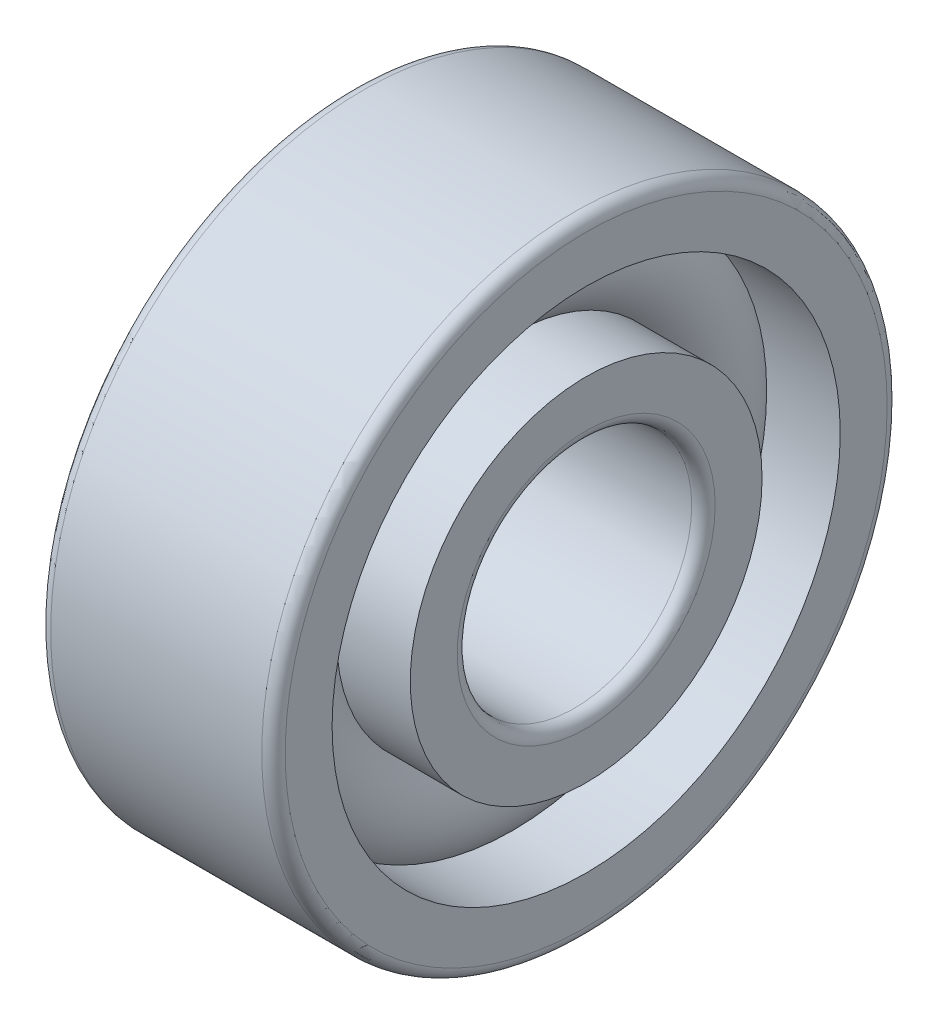
from build123d import *

# Parameters (mm, degrees)
CAGSPISKE_W     = 0.15
CAGSPISKE_H     = 0.25
CAGESPINE_ANGLE = 0.001
BALSIMSKE_R     = 0.75


with BuildPart() as part:
    # CagSpiSke → CageSpine (revolve)
    with BuildSketch(Plane.XY):
        with Locations((0, 2.75)):
            Rectangle(CAGSPISKE_W, CAGSPISKE_H)
    revolve(axis=Axis((-20.6375, 0, 0), (-1, 0, 0)), revolution_arc=CAGESPINE_ANGLE)

    # BalSimSke → BallsSimplified (revolve)
    with BuildSketch(Plane.XY):
        with Locations((0, 2.75)):
            Circle(BALSIMSKE_R)
    revolve(axis=Axis((-10, 0, 0), (1, 0, 0)))

    # InnRacSke → InnerRace (revolve)
    with BuildSketch(Plane.XY):
        with BuildLine():
            Line((-0.525, 2.25), (-1.5, 2.25))
            Line((-1.5, 2.25), (-1.5, 1.65))
            ThreePointArc((-1.5, 1.65), (-1.456066017, 1.543933983), (-1.35, 1.5))
            Line((-1.35, 1.5), (1.35, 1.5))
            ThreePointArc((1.35, 1.5), (1.456066017, 1.543933983), (1.5, 1.65))
            Line((1.5, 1.65), (1.5, 2.25))
            Line((1.5, 2.25), (0.525, 2.25))
            ThreePointArc((0.525, 2.25), (0, 2.025), (-0.525, 2.25))
        make_face()
    revolve(axis=Axis((-20.6375, 0, 0), (1, 0, 0)))

    # OutRacSke → OuterRace (revolve)
    with BuildSketch(Plane.XY):
        with BuildLine():
            Line((-0.525, 3.25), (-1.5, 3.25))
            Line((-1.5, 3.25), (-1.5, 3.85))
            ThreePointArc((-1.5, 3.85), (-1.456066017, 3.956066017), (-1.35, 4))
            Line((-1.35, 4), (1.35, 4))
            ThreePointArc((1.35, 4), (1.456066017, 3.956066017), (1.5, 3.85))
            Line((1.5, 3.85), (1.5, 3.25))
            Line((1.5, 3.25), (0.525, 3.25))
            ThreePointArc((0.525, 3.25), (0, 3.475), (-0.525, 3.25))
        make_face()
    revolve(axis=Axis((-20.6375, 0, 0), (1, 0, 0)))


solid = part.part
